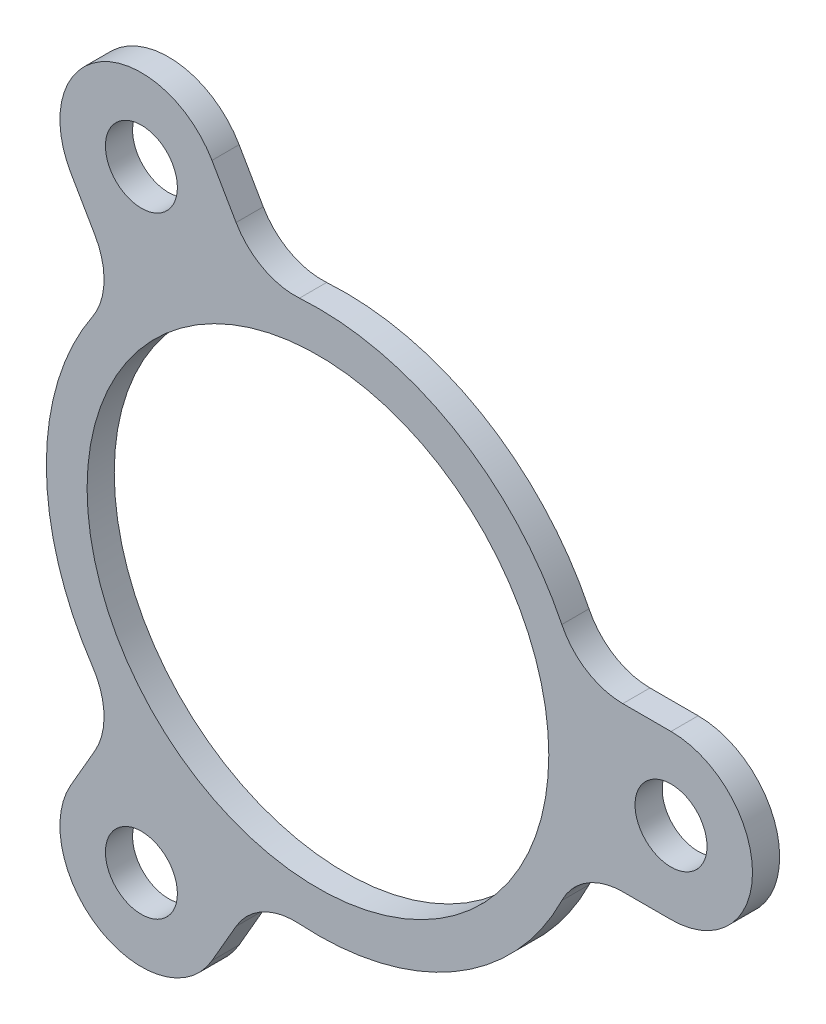
from build123d import *

# Parameters (mm, degrees)
SKETCH1_R            = 17
BOSS_EXTRUDE1_DEPTH  = 2
M5_CLEARANCE_HOLE1_D = 5.3
FILLET1_R            = 5


with BuildPart() as part:
    # Sketch1 → Boss-Extrude1 (new body)
    with BuildSketch(Plane.XY.offset(92)):
        with BuildLine():
            ThreePointArc((26, -6), (32, 0), (26, 6))
            Line((26, 6), (19.078784028, 6))
            ThreePointArc((19.078784028, 6), (10, 17.320508076), (-4.343239591, 19.522711642))
            Line((-4.343239591, 19.522711642), (-7.803847577, 25.516660498))
            ThreePointArc((-7.803847577, 25.516660498), (-16, 27.712812921), (-18.196152423, 19.516660498))
            Line((-18.196152423, 19.516660498), (-14.735544437, 13.522711642))
            ThreePointArc((-14.735544437, 13.522711642), (-20, 0), (-14.735544437, -13.522711642))
            Line((-14.735544437, -13.522711642), (-18.196152423, -19.516660498))
            ThreePointArc((-18.196152423, -19.516660498), (-16, -27.712812921), (-7.803847577, -25.516660498))
            Line((-7.803847577, -25.516660498), (-4.343239591, -19.522711642))
            ThreePointArc((-4.343239591, -19.522711642), (10, -17.320508076), (19.078784028, -6))
            Line((19.078784028, -6), (26, -6))
        make_face()
        Circle(SKETCH1_R, mode=Mode.SUBTRACT)
    extrude(amount=BOSS_EXTRUDE1_DEPTH)

    # M5 Clearance Hole1 (through all)
    with Locations(Plane.XY.offset(94)):
        with Locations((-13, 22.516660498), (26, 0), (-13, -22.516660498)):
            Hole(M5_CLEARANCE_HOLE1_D / 2)

    # Fillet1
    fillet1_edges = [part.edges().sort_by_distance(p)[0] for p in [
        (-4.343239591, -19.522711642, 93),
        (19.078784028, -6, 93),
        (19.078784028, 6, 93),
        (-4.343239591, 19.522711642, 93),
        (-14.735544437, 13.522711642, 93),
        (-14.735544437, -13.522711642, 93),
    ]]
    fillet(fillet1_edges, radius=FILLET1_R)


solid = part.part
